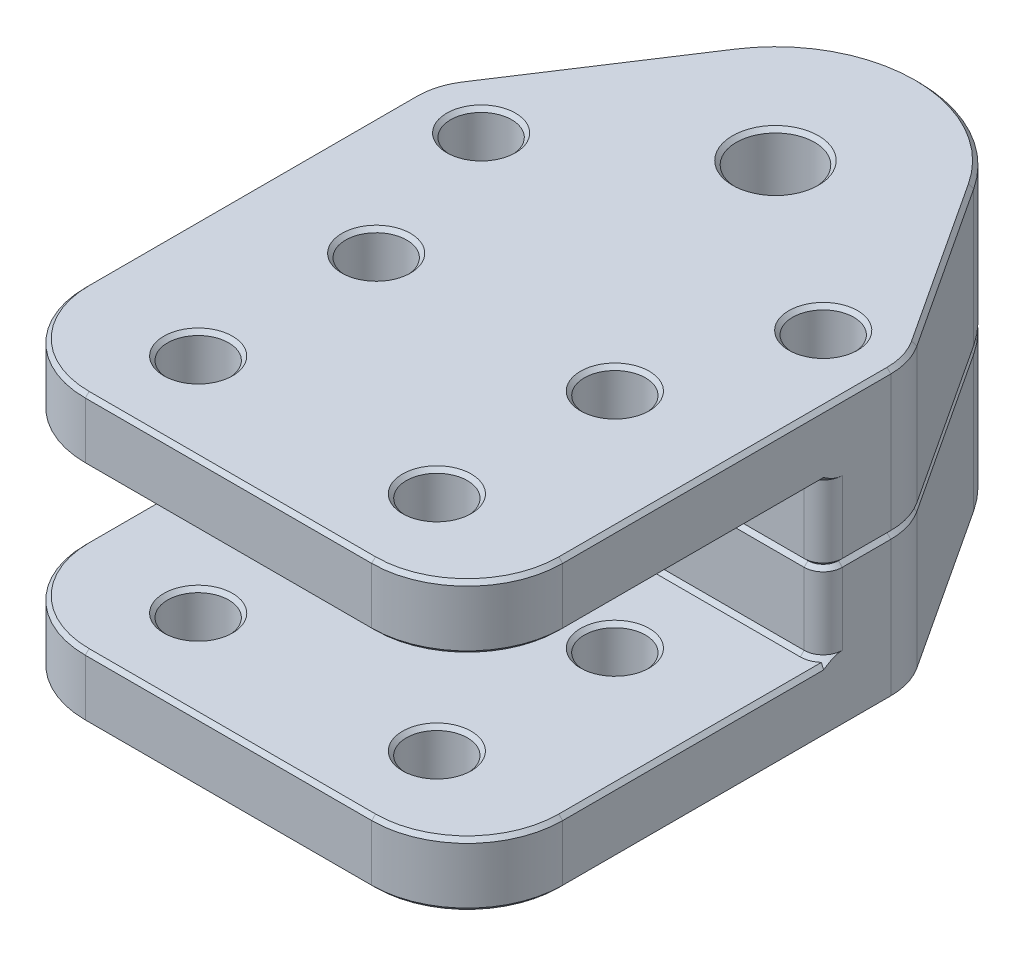
from build123d import *

# Parameters (mm, degrees)
BOSS_EXTRUDE1_DEPTH = 50
SKETCH2_R           = 4.1
SKETCH2_R_2         = 3.2
CUT_EXTRUDE1_DEPTH  = 65.152506576
FILLET1_R           = 10
FILLET2_R           = 2
CHAMFER1_SIZE       = 0.4
CHAMFER2_SIZE       = 0.4
CHAMFER3_SIZE       = 0.4


with BuildPart() as part:
    # Sketch1 → Boss-Extrude1 (new body)
    with BuildSketch(Plane.YZ):
        Polygon((-8.33, 0), (-8.33, 37.29), (-15, 37.29), (-15, -35), (0, -35), (0, 0), align=None)
    extrude(amount=-BOSS_EXTRUDE1_DEPTH)

    # Sketch2 → Cut-Extrude1 (cut, through all)
    with BuildSketch(Plane.XZ.offset(15)):
        with BuildLine():
            ThreePointArc((-12.450063301, -28.215782911), (-17.866864072, -33.195392068), (-25, -35))
            Line((-25, -35), (0, -35))
            Line((0, -35), (0, -7.084973779))
            ThreePointArc((0, -7.084973779), (-0.295471748, -9.109699838), (-1.157242283, -10.965547545))
            Line((-1.157242283, -10.965547545), (-12.450063301, -28.215782911))
        make_face()
        with BuildLine():
            Line((-50, -35), (-25, -35))
            ThreePointArc((-25, -35), (-32.133135928, -33.195392068), (-37.549936699, -28.215782911))
            Line((-37.549936699, -28.215782911), (-48.842757717, -10.965547545))
            ThreePointArc((-48.842757717, -10.965547545), (-49.704528254, -9.109699834), (-50, -7.08497377))
            Line((-50, -7.08497377), (-50, -35))
        make_face()
        with Locations((-25, -20)):
            Circle(SKETCH2_R)
        with Locations((-42.915026221, -7.084973779)):
            Circle(SKETCH2_R_2)
        with Locations((-7.084973779, -7.084973779)):
            Circle(SKETCH2_R_2)
        with Locations((-37.5, 27.9675)):
            Circle(SKETCH2_R_2)
        with Locations((-37.5, 9.3225)):
            Circle(SKETCH2_R_2)
        with Locations((-12.5, 27.9675)):
            Circle(SKETCH2_R_2)
        with Locations((-12.5, 9.3225)):
            Circle(SKETCH2_R_2)
    extrude(amount=-CUT_EXTRUDE1_DEPTH, mode=Mode.SUBTRACT)

    # Fillet1
    fillet1_edges = [part.edges().sort_by_distance(p)[0] for p in [
        (-50, -11.665, 37.29),
        (0, -11.665, 37.29),
    ]]
    fillet(fillet1_edges, radius=FILLET1_R)

    # Fillet2
    fillet2_edges = [part.edges().sort_by_distance(p)[0] for p in [
        (0, -4.165, 0),
        (-50, -4.165, 0),
    ]]
    fillet(fillet2_edges, radius=FILLET2_R)

    # Chamfer1
    chamfer1_edges = [part.edges().sort_by_distance(p)[0] for p in [
        (-40.7, -8.33, 9.3225),
        (-40.7, -8.33, 27.9675),
        (-15.7, -8.33, 27.9675),
        (-15.7, -8.33, 9.3225),
        (-10.284973779, -15, -7.084973779),
        (-40.7, -15, 9.3225),
        (-40.7, -15, 27.9675),
        (-15.7, -15, 27.9675),
        (-15.7, -15, 9.3225),
        (-29.1, -15, -20),
        (-46.115026221, -15, -7.084973779),
        (-2.928932188, -15, 34.361067812),
        (0, -15, 10.102513111),
        (-0.295471748, -15, -9.109699838),
        (-6.803652792, -15, -19.590665228),
        (-25, -15, -35),
        (-43.196347208, -15, -19.590665228),
        (-49.704528254, -15, -9.109699834),
        (-50, -15, 10.102513115),
        (-47.071067812, -15, 34.361067812),
        (-25, -15, 37.29),
        (-49.414213562, 0, -0.585786438),
        (-50, 0, -4.542486885),
        (-49.704528254, 0, -9.109699834),
        (-43.196347208, 0, -19.590665228),
        (-25, 0, -35),
        (-6.803652792, 0, -19.590665228),
        (-0.295471748, 0, -9.109699838),
        (0, 0, -4.542486889),
        (-0.585786438, 0, -0.585786438),
        (-25, 0, 0),
        (-10.284973779, 0, -7.084973779),
        (-29.1, 0, -20),
        (-46.115026221, 0, -7.084973779),
    ]]
    chamfer(chamfer1_edges, length=CHAMFER1_SIZE)

    # Chamfer2
    chamfer2_edges = [part.edges().sort_by_distance(p)[0] for p in [
        (-49.414213562, -8.33, -0.585786438),
        (-0.585786438, -8.33, -0.585786438),
        (-25, -8.33, 0),
    ]]
    chamfer(chamfer2_edges, length=CHAMFER2_SIZE)

    # Chamfer3
    chamfer3_edges = [part.edges().sort_by_distance(p)[0] for p in [
        (-50, -8.33, 13.308324958),
        (0, -8.33, 13.308324958),
        (-47.071067812, -8.33, 34.361067812),
        (-2.928932188, -8.33, 34.361067812),
        (-25, -8.33, 37.29),
    ]]
    chamfer(chamfer3_edges, length=CHAMFER3_SIZE)


with BuildPart() as body_2:
    # Mirror1: mirrored copy
    add(part.part.mirror(Plane(origin=(-50, 0, 0), x_dir=(0, 0, 1), z_dir=(0, 1, 0))))


solid = Compound([part.part, body_2.part])
